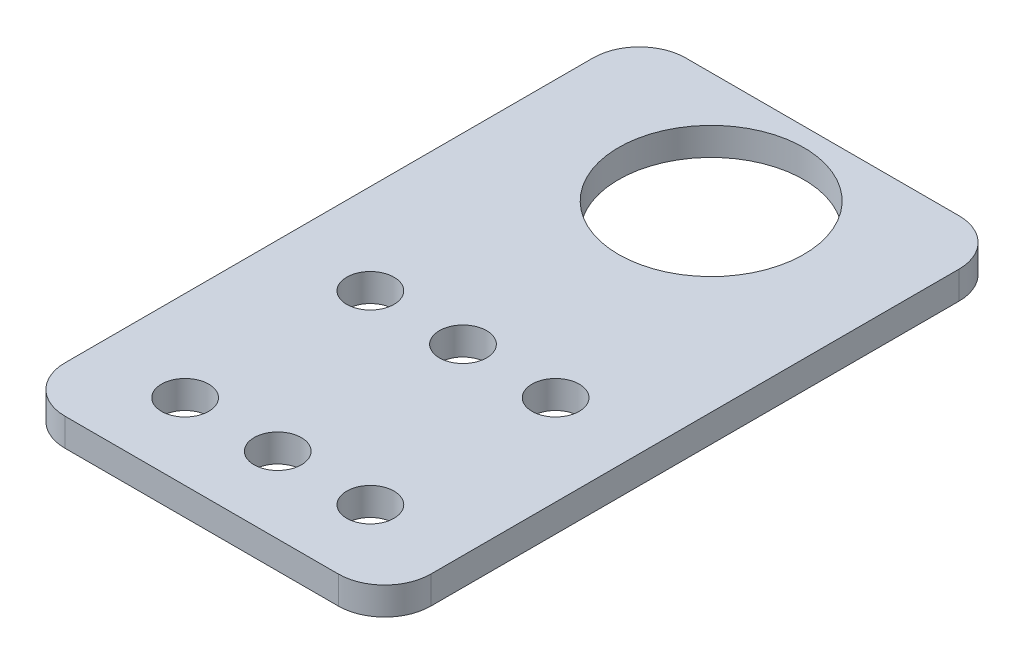
from build123d import *

# Parameters (mm, degrees)
SKETCH1_R           = 2.55
BOSS_EXTRUDE1_DEPTH = 3
SKETCH2_R           = 10
CUT_EXTRUDE2_DEPTH  = 40.004006204


with BuildPart() as part:
    # Sketch1 → Boss-Extrude1 (new body)
    with BuildSketch(Plane(origin=(0, 0, 0), x_dir=(1, 0, 0), z_dir=(0, 1, 0))):
        with BuildLine():
            Line((14.75, -33.5), (-14.75, -33.5))
            ThreePointArc((-14.75, -33.5), (-18.285533906, -32.035533906), (-19.75, -28.5))
            Line((-19.75, -28.5), (-19.75, 28.5))
            ThreePointArc((-19.75, 28.5), (-18.285533906, 32.035533906), (-14.75, 33.5))
            Line((-14.75, 33.5), (14.75, 33.5))
            ThreePointArc((14.75, 33.5), (18.285533906, 32.035533906), (19.75, 28.5))
            Line((19.75, 28.5), (19.75, -28.5))
            ThreePointArc((19.75, -28.5), (18.285533906, -32.035533906), (14.75, -33.5))
        make_face()
        with Locations((0, 26.5)):
            Circle(SKETCH1_R, mode=Mode.SUBTRACT)
        with Locations((10, -25.29)):
            Circle(SKETCH1_R, mode=Mode.SUBTRACT)
        with Locations((10, -5.29)):
            Circle(SKETCH1_R, mode=Mode.SUBTRACT)
        with Locations((0, -25.29)):
            Circle(SKETCH1_R, mode=Mode.SUBTRACT)
        with Locations((0, -5.29)):
            Circle(SKETCH1_R, mode=Mode.SUBTRACT)
        with Locations((-10, -25.29)):
            Circle(SKETCH1_R, mode=Mode.SUBTRACT)
        with Locations((-10, -5.29)):
            Circle(SKETCH1_R, mode=Mode.SUBTRACT)
    extrude(amount=BOSS_EXTRUDE1_DEPTH)

    # Sketch2 → Cut-Extrude2 (cut, through all)
    with BuildSketch(Plane(origin=(0, 3, 0), x_dir=(1, 0, 0), z_dir=(0, 1, 0))):
        with Locations((0, 21.5)):
            Circle(SKETCH2_R)
    extrude(amount=-CUT_EXTRUDE2_DEPTH, mode=Mode.SUBTRACT)


solid = part.part
